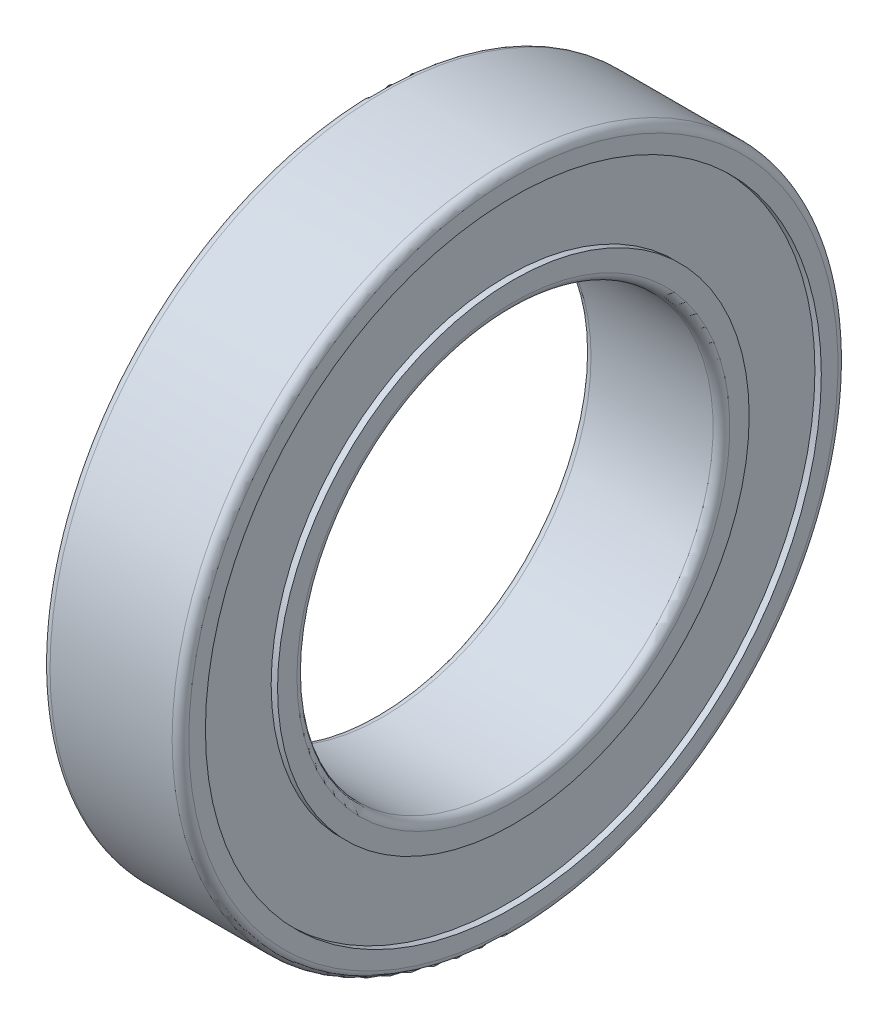
from build123d import *

# Parameters (mm, degrees)
FILLET1_R = 0.3
FILLET2_R = 0.3


with BuildPart() as part:
    # Sketch1 → Revolve1 (revolve)
    with BuildSketch(Plane.XY):
        Polygon((0, 7.5), (5, 7.5), (5, 8.5), (4.77, 8.5), (4.77, 11.1), (5, 11.1), (5, 12), (0, 12), (0, 11.1), (0.23, 11.1), (0.23, 8.5), (0, 8.5), align=None)
    revolve(axis=Axis((0, 0, 0), (1, 0, 0)))

    # Fillet1
    fillet1_edges = [part.edges().sort_by_distance(p)[0] for p in [
        (5, -12, 0),
        (0, -12, 0),
    ]]
    fillet(fillet1_edges, radius=FILLET1_R)

    # Fillet2
    fillet2_edges = [part.edges().sort_by_distance(p)[0] for p in [
        (5, -7.5, 0),
        (0, -7.5, 0),
    ]]
    fillet(fillet2_edges, radius=FILLET2_R)


solid = part.part
